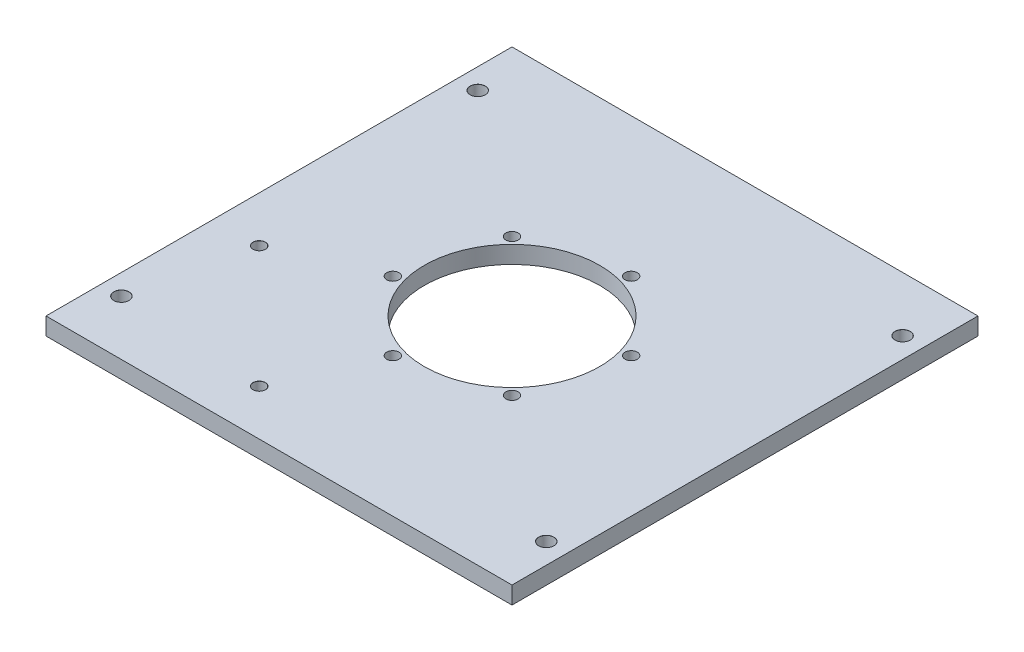
from build123d import *

# Parameters (mm, degrees)
SKETCH1_W                      = 170
SKETCH1_H                      = 170
SKETCH1_R                      = 32
BOSS_EXTRUDE3_DEPTH            = 6.35
M4_CLEARANCE_HOLE2_D           = 4.5
M4_CLEARANCE_HOLE2_CSINK_D     = 4.55
M4_CLEARANCE_HOLE2_CSINK_ANGLE = 90
M4_CLEARANCE_HOLE5_D           = 4.5
M4_CLEARANCE_HOLE5_CSINK_D     = 4.55
M4_CLEARANCE_HOLE5_CSINK_ANGLE = 90
M5_CLEARANCE_HOLE1_D           = 5.5
M5_CLEARANCE_HOLE1_CSINK_D     = 5.55
M5_CLEARANCE_HOLE1_CSINK_ANGLE = 90


with BuildPart() as part:
    # Sketch1 → Boss-Extrude3 (new body)
    with BuildSketch(Plane(origin=(0, 0, 0), x_dir=(1, 0, 0), z_dir=(0, 1, 0))):
        Rectangle(SKETCH1_W, SKETCH1_H)
        Circle(SKETCH1_R, mode=Mode.SUBTRACT)
    extrude(amount=BOSS_EXTRUDE3_DEPTH)

    # M4 Clearance Hole2 (through all)
    with Locations(Plane(origin=(0, 0, 0), x_dir=(-1, 0, 0), z_dir=(0, -1, 0))):
        with Locations((-9.188076101, 34.290366833), (25.102290732, 25.102290732), (34.290366833, -9.188076101), (9.188076101, -34.290366833), (-25.102290732, -25.102290732), (-34.290366833, 9.188076101)):
            CounterSinkHole(M4_CLEARANCE_HOLE2_D / 2, M4_CLEARANCE_HOLE2_CSINK_D / 2, counter_sink_angle=M4_CLEARANCE_HOLE2_CSINK_ANGLE)

    # M4 Clearance Hole5 (through all)
    with Locations(Plane(origin=(0, 6.35, 0), x_dir=(1, 0, 0), z_dir=(0, 1, 0))):
        with Locations((-68.301673362, -23.916580707), (-23.916580707, -68.301673362)):
            CounterSinkHole(M4_CLEARANCE_HOLE5_D / 2, M4_CLEARANCE_HOLE5_CSINK_D / 2, counter_sink_angle=M4_CLEARANCE_HOLE5_CSINK_ANGLE)

    # M5 Clearance Hole1 (through all)
    with Locations(Plane(origin=(0, 6.35, 0), x_dir=(1, 0, 0), z_dir=(0, 1, 0))):
        with Locations((-77.5, 65), (77.5, 65), (77.5, -65), (-77.5, -65)):
            CounterSinkHole(M5_CLEARANCE_HOLE1_D / 2, M5_CLEARANCE_HOLE1_CSINK_D / 2, counter_sink_angle=M5_CLEARANCE_HOLE1_CSINK_ANGLE)


solid = part.part
